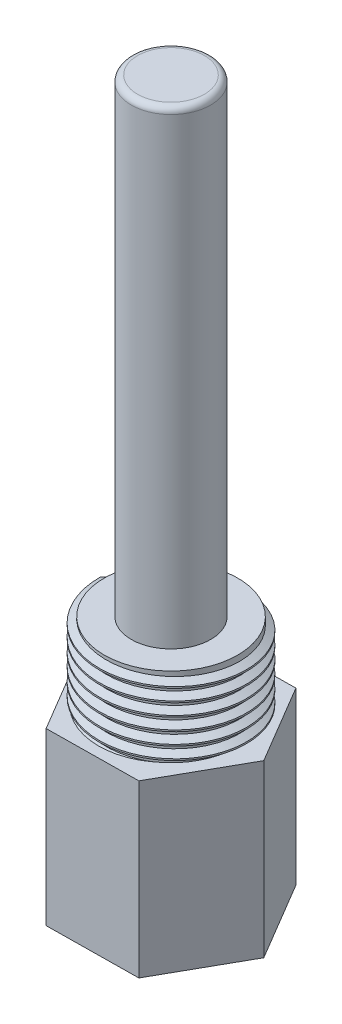
from build123d import *
from build123d.topology import SkipClean

# Parameters (mm, degrees)
SALIENTE_EXTRUIR1_DEPTH = 27.3
CROQUIS6_R              = 10.67
SALIENTE_EXTRUIR3_DEPTH = 12.7
CROQUIS7_R              = 6.35
SALIENTE_EXTRUIR4_DEPTH = 75
REDONDEO2_R             = 1
CROQUIS8_R              = 3.175
CORTAR_EXTRUIR1_DEPTH   = 113
CROQUIS12_R             = 9.525
CORTAR_EXTRUIR2_DEPTH   = 24
ROSCA1_PITCH            = 2
ROSCA2_PITCH            = 2


with BuildPart() as part:
    # Croquis1 → Saliente-Extruir1 (new body)
    with BuildSketch(Plane(origin=(0, 0, 0), x_dir=(1, 0, 0), z_dir=(0, 1, 0))):
        Polygon((-7.478567192, 12.614450685), (-14.663718344, -0.16940383), (-7.185151152, -12.783854515), (7.478567192, -12.614450685), (14.663718344, 0.16940383), (7.185151152, 12.783854515), align=None)
    extrude(amount=SALIENTE_EXTRUIR1_DEPTH)

    # Croquis6 → Saliente-Extruir3 (add)
    with BuildSketch(Plane(origin=(0, 27.3, 0), x_dir=(1, 0, 0), z_dir=(0, 1, 0))):
        with Locations(Location((0, 0, 0), (0, 0, 270))):
            Circle(CROQUIS6_R)
    extrude(amount=SALIENTE_EXTRUIR3_DEPTH)

    # Croquis7 → Saliente-Extruir4 (add)
    with BuildSketch(Plane(origin=(0, 40, 0), x_dir=(1, 0, 0), z_dir=(0, 1, 0))):
        with Locations(Location((0, 0, 0), (0, 0, 270))):
            Circle(CROQUIS7_R)
    extrude(amount=SALIENTE_EXTRUIR4_DEPTH)

    # Redondeo2
    redondeo2_edges = [part.edges().sort_by_distance(p)[0] for p in [
        (0, 115, -6.35),
    ]]
    fillet(redondeo2_edges, radius=REDONDEO2_R)

    # Croquis8 → Cortar-Extruir1 (cut)
    with BuildSketch(Plane(origin=(0, 0, 0), x_dir=(-1, 0, 0), z_dir=(0, -1, 0))):
        with Locations(Location((0, 0, 0), (0, 0, 90))):
            Circle(CROQUIS8_R)
    extrude(amount=-CORTAR_EXTRUIR1_DEPTH, mode=Mode.SUBTRACT)

    # Croquis12 → Cortar-Extruir2 (cut)
    with BuildSketch(Plane.XZ):
        with Locations(Location((0, 0, 0), (0, 0, 270))):
            Circle(CROQUIS12_R)
    extrude(amount=-CORTAR_EXTRUIR2_DEPTH, mode=Mode.SUBTRACT)

    # Rosca1: the profile of Perfil de rosca1 profile screwed along a right-hand helix of 12 turns, 10 arcs to a turn; built about Z, then put on its axis
    with SkipClean():  # the faces are left unmerged after this step: merging them gives an invalid solid
        rosca1_z = Axis((0, 0, 0), (0, 0, 1))
        rosca1_corners = [(9.5247, 0, -0.000173205), (10.60753175, 0, 0.624999997), (10.60753175, 0, 0.874999997), (9.5247, 0, 1.5001732)]
        with BuildLine(mode=Mode.PRIVATE) as rosca1_profile:
            Line(rosca1_corners[0], rosca1_corners[1])
            Line(rosca1_corners[1], rosca1_corners[2])
            Line(rosca1_corners[2], rosca1_corners[3])
            Line(rosca1_corners[3], rosca1_corners[0])
        rosca1_cap = Face(rosca1_profile.wire())
        rosca1_turn_angles = [0, 18, 36, 54, 72, 90, 108, 126, 144, 162, 180, 198, 216, 234, 252, 270, 288, 306, 324, 342, 360]
        rosca1_turn_weights = [1, 0.9510565162951535, 1, 0.9510565162951535, 1, 0.9510565162951535, 1, 0.9510565162951535, 1, 0.9510565162951535, 1, 0.9510565162951535, 1, 0.9510565162951535, 1, 0.9510565162951535, 1, 0.9510565162951535, 1, 0.9510565162951535, 1]
        rosca1_turn_rails = [Edge.make_bspline([Vector(p[0], p[1], 0).rotate(rosca1_z, rosca1_turn_angles[k]) / rosca1_turn_weights[k] + Vector(0, 0, p[2] + ROSCA1_PITCH * rosca1_turn_angles[k] / 360) for k in range(21)], [0, 0, 0, 1, 1, 2, 2, 3, 3, 4, 4, 5, 5, 6, 6, 7, 7, 8, 8, 9, 9, 10, 10, 10], 2, rosca1_turn_weights) for p in rosca1_corners]
        rosca1_turn_sides = [Face.make_surface_from_curves(rosca1_turn_rails[p[0]], rosca1_turn_rails[p[1]]) for p in [(0, 1), (1, 2), (2, 3), (3, 0)]]
        rosca1 = Plane(origin=(0, 0, 0), x_dir=(1, 0, 0), z_dir=(0, 1, 0)) * Solid(Shell([*[p.moved(Location((0, 0, ROSCA1_PITCH * i))) for i in range(12) for p in rosca1_turn_sides], rosca1_cap, rosca1_cap.rotate(rosca1_z, 4320).moved(Location((0, 0, ROSCA1_PITCH * 4320 / 360)))]))
        add(rosca1, mode=Mode.SUBTRACT)

    # Rosca2: the profile of Perfil de rosca5 profile screwed along a left-hand helix of 6.35 turns, 10 arcs to a turn; built about Z, then put on its axis
    with SkipClean():  # the faces are left unmerged after this step: merging them gives an invalid solid
        rosca2_z = Axis((0, 0, 0), (0, 0, 1))
        rosca2_corners = [(10.6697, 4e-09, -0.000173205), (11.75253175, 5e-09, 0.624999997), (11.75253175, 5e-09, 0.874999997), (10.6697, 4e-09, 1.5001732)]
        with BuildLine(mode=Mode.PRIVATE) as rosca2_profile:
            Line(rosca2_corners[0], rosca2_corners[1])
            Line(rosca2_corners[1], rosca2_corners[2])
            Line(rosca2_corners[2], rosca2_corners[3])
            Line(rosca2_corners[3], rosca2_corners[0])
        rosca2_cap = Face(rosca2_profile.wire())
        rosca2_turn_angles = [0, -18, -36, -54, -72, -90, -108, -126, -144, -162, -180, -198, -216, -234, -252, -270, -288, -306, -324, -342, -360]
        rosca2_turn_weights = [1, 0.9510565162951535, 1, 0.9510565162951535, 1, 0.9510565162951535, 1, 0.9510565162951535, 1, 0.9510565162951535, 1, 0.9510565162951535, 1, 0.9510565162951535, 1, 0.9510565162951535, 1, 0.9510565162951535, 1, 0.9510565162951535, 1]
        rosca2_turn_rails = [Edge.make_bspline([Vector(p[0], p[1], 0).rotate(rosca2_z, rosca2_turn_angles[k]) / rosca2_turn_weights[k] + Vector(0, 0, p[2] + -ROSCA2_PITCH * rosca2_turn_angles[k] / 360) for k in range(21)], [0, 0, 0, 1, 1, 2, 2, 3, 3, 4, 4, 5, 5, 6, 6, 7, 7, 8, 8, 9, 9, 10, 10, 10], 2, rosca2_turn_weights) for p in rosca2_corners]
        rosca2_turn_sides = [Face.make_surface_from_curves(rosca2_turn_rails[p[0]], rosca2_turn_rails[p[1]]) for p in [(0, 1), (1, 2), (2, 3), (3, 0)]]
        rosca2_last_angles = [-2160, -2178, -2196, -2214, -2232, -2250, -2268, -2277, -2286]
        rosca2_last_weights = [1, 0.9510565162951535, 1, 0.9510565162951535, 1, 0.9510565162951535, 1, 0.9876883405951378, 1]
        rosca2_last_rails = [Edge.make_bspline([Vector(p[0], p[1], 0).rotate(rosca2_z, rosca2_last_angles[k]) / rosca2_last_weights[k] + Vector(0, 0, p[2] + -ROSCA2_PITCH * rosca2_last_angles[k] / 360) for k in range(9)], [0, 0, 0, 1, 1, 2, 2, 3, 3, 4, 4, 4], 2, rosca2_last_weights) for p in rosca2_corners]
        rosca2_last_sides = [Face.make_surface_from_curves(rosca2_last_rails[p[0]], rosca2_last_rails[p[1]]) for p in [(0, 1), (1, 2), (2, 3), (3, 0)]]
        rosca2 = Plane(origin=(0, 40, 0), x_dir=(-0.999450216, 0, -0.033155178), z_dir=(0, -1, 0)) * Solid(Shell([*[p.moved(Location((0, 0, ROSCA2_PITCH * i))) for i in range(6) for p in rosca2_turn_sides], *rosca2_last_sides, rosca2_cap, rosca2_cap.rotate(rosca2_z, -2286).moved(Location((0, 0, -ROSCA2_PITCH * -2286 / 360)))]))
        add(rosca2)


solid = part.part
